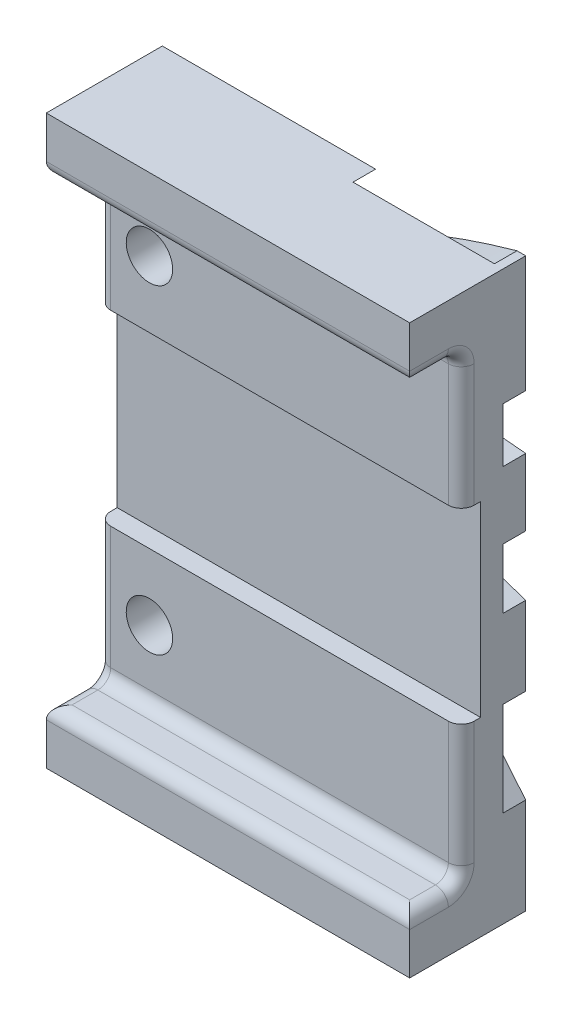
from build123d import *

# Parameters (mm, degrees)
BOSS_EXTRUDE1_DEPTH      = 11
BOSS_EXTRUDE1_DEPTH_BACK = 2
SKETCH1_W                = 28.18
SKETCH1_H                = 44
CUT_EXTRUDE1_DEPTH       = 37
SKETCH4_W                = 20.18
SKETCH4_H                = 4
CUT_EXTRUDE2_DEPTH       = 48
CUT_EXTRUDE3_DEPTH       = 1.75
SKETCH7_R                = 1.8
CUT_EXTRUDE4_DEPTH       = 23
SKETCH10_W               = 11.795844225
SKETCH10_H               = 4.586005201
CUT_EXTRUDE7_DEPTH       = 53
FILLET1_R                = 1
SKETCH8_R                = 3.25
CUT_EXTRUDE5_DEPTH       = 1.75


with BuildPart() as part:
    # Sketch1 → Boss-Extrude1 (new, two sides: drawn at the far end of the back side and taken through both)
    with BuildSketch(Plane.XY.offset(-BOSS_EXTRUDE1_DEPTH_BACK)):
        Rectangle(SKETCH1_W, SKETCH1_H)
    extrude(amount=BOSS_EXTRUDE1_DEPTH + BOSS_EXTRUDE1_DEPTH_BACK)

    # Sketch3 → Cut-Extrude1 (cut)
    with BuildSketch(Plane.ZY.offset(14.09)):
        Polygon((8, 7.25), (11, 7.25), (11, -7.25), (8, -7.25), (8, -17.75), (3, -17.75), (3, -7.25), (1.5033938, -7.25), (1.5033938, 7.25), (3, 7.25), (3, 17.75), (8, 17.75), align=None)
    extrude(amount=-CUT_EXTRUDE1_DEPTH, mode=Mode.SUBTRACT)

    # Sketch4 → Cut-Extrude2 (cut)
    with BuildSketch(Plane.XZ.offset(22)):
        with Locations((4, 9)):
            Rectangle(SKETCH4_W, SKETCH4_H)
    extrude(amount=-CUT_EXTRUDE2_DEPTH, mode=Mode.SUBTRACT)

    # Sketch5 → Cut-Extrude3 (cut)
    with BuildSketch(Plane(origin=(0, 0, -2), x_dir=(-1, 0, 0), z_dir=(0, 0, -1))):
        with BuildLine():
            add(Edge.make_bspline(
                [(-2.448223174, 22), (19.56705897, 11.536361781), (5.151599528, -7.62224079), (5.592236917, -22)],
                knots=[0, 0, 0, 0, 0.832841206, 0.832841206, 0.832841206, 0.832841206], degree=3))
            Line((-2.448223174, 22), (-13.413117725, 22))
            add(Edge.make_bspline(
                [(-13.413117725, 22), (18.496116363, 13.047461166), (3.546154763, -4.863207343), (0.001206333, -22)],
                knots=[0, 0, 0, 0, 0.886771983, 0.886771983, 0.886771983, 0.886771983], degree=3))
            Line((0.001206333, -22), (5.592236917, -22))
        make_face()
        with BuildLine():
            Line((-9.422350513, -22), (-5.513274624, -22))
            add(Edge.make_bspline(
                [(-14.09, 12.943541527), (17.027152303, 14.230895657), (-0.913223026, -5.637747584), (-5.513274624, -22)],
                knots=[0, 0, 0, 0, 0.88215351, 0.88215351, 0.88215351, 0.88215351], degree=3))
            Line((-14.09, 12.943541527), (-14.09, 8.727219843))
            add(Edge.make_bspline(
                [(-14.09, 8.727219843), (12.710361443, 11.678555955), (-5.250487577, -7.026945605), (-9.422350513, -22)],
                knots=[0, 0, 0, 0, 0.871233208, 0.871233208, 0.871233208, 0.871233208], degree=3))
        make_face()
        with BuildLine():
            add(Edge.make_bspline(
                [(-14.09, 3.523280295), (7.913446573, 11.6376574), (-14.09, -14.545652593)],
                knots=[0, 0, 0, 1, 1, 1], degree=2))
            Line((-14.09, 3.523280295), (-14.09, -1.131328535))
            add(Edge.make_bspline(
                [(-14.09, -1.131328535), (-1.654052468, 3.211926994), (-14.09, -7.240502624)],
                knots=[0, 0, 0, 1, 1, 1], degree=2))
            Line((-14.09, -7.240502624), (-14.09, -14.545652593))
        make_face()
    extrude(amount=-CUT_EXTRUDE3_DEPTH, mode=Mode.SUBTRACT)

    # Sketch7 → Cut-Extrude4 (cut)
    with BuildSketch(Plane.XY.offset(11)):
        with Locations((-10.09, 12.4)):
            Circle(SKETCH7_R)
        with Locations((-10.09, -12.4)):
            Circle(SKETCH7_R)
    extrude(amount=-CUT_EXTRUDE4_DEPTH, mode=Mode.SUBTRACT)

    # Sketch10 → Cut-Extrude7 (cut)
    with BuildSketch(Plane(origin=(0, 22, 0), x_dir=(1, 0, 0), z_dir=(0, 1, 0))):
        with Locations((-10.712086776, -9.2930026)):
            Rectangle(SKETCH10_W, SKETCH10_H)
    extrude(amount=-CUT_EXTRUDE7_DEPTH, mode=Mode.SUBTRACT)

    # Fillet1
    fillet1_edges = [part.edges().sort_by_distance(p)[0] for p in [
        (-14.09, -12.5, 3),
        (14.09, -12.5, 3),
        (14.09, 12.5, 3),
        (-14.09, 12.5, 3),
        (-14.09, -17.75, 5),
        (0, -17.75, 3),
        (14.09, -17.75, 5),
        (0, -17.75, 7),
        (14.09, 17.75, 5),
        (0, 17.75, 3),
        (-14.09, 17.75, 5),
        (0, 17.75, 7),
    ]]
    fillet(fillet1_edges, radius=FILLET1_R)

    # Sketch8 → Cut-Extrude5 (cut)
    with BuildSketch(Plane(origin=(0, 0, -2), x_dir=(-1, 0, 0), z_dir=(0, 0, -1))):
        with Locations((10.09, -12.4)):
            Circle(SKETCH8_R)
        with Locations((10.09, 12.4)):
            Circle(SKETCH8_R)
    extrude(amount=-CUT_EXTRUDE5_DEPTH, mode=Mode.SUBTRACT)


solid = part.part
